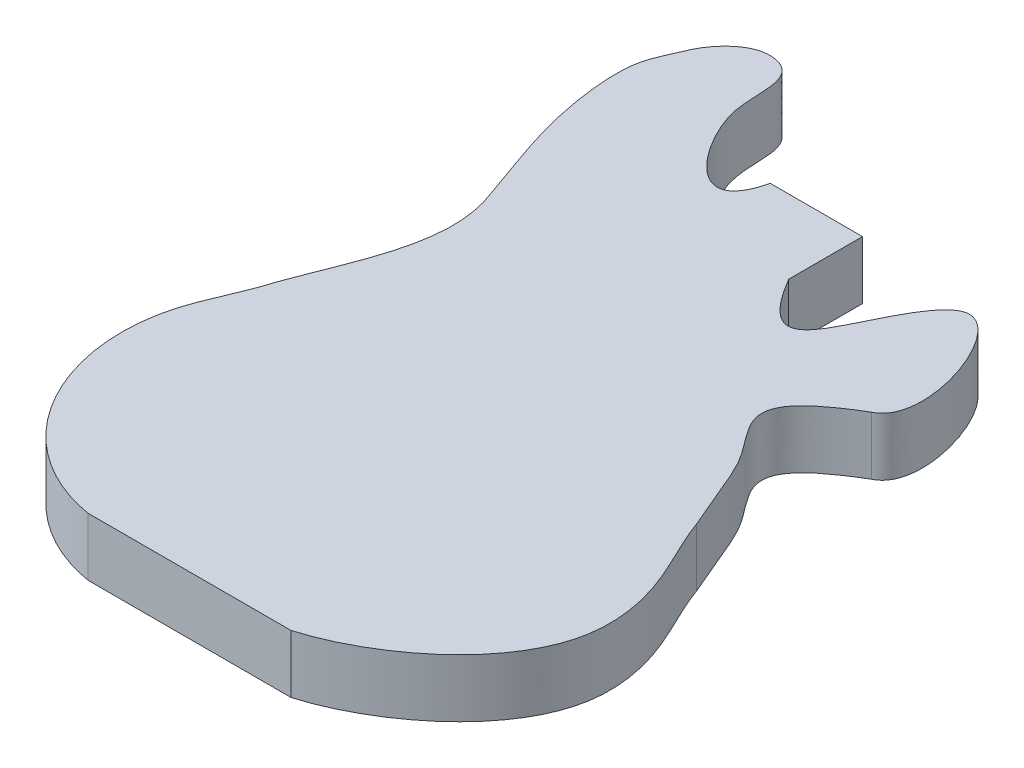
from build123d import *

# Parameters (mm, degrees)
BOSS_EXTRUDE1_DEPTH = 40.005


with BuildPart() as part:
    # Sketch1 → Boss-Extrude1 (new body)
    with BuildSketch(Plane(origin=(0, 0, 0), x_dir=(1, 0, 0), z_dir=(0, 1, 0))):
        with BuildLine():
            Line((-31.75, 431.8), (31.75, 431.8))
            Line((31.75, 431.8), (31.75, 381))
            add(Edge.make_bspline(
                [(139.7, 330.2), (166.445933937, 342.89199921), (123.503776034, 464.530793204), (76.812686628, 369.38946014), (59.509313942, 333.666820551), (31.75, 381)],
                knots=[0, 0, 0, 0, 0.451982316, 0.679896033, 1, 1, 1, 1], degree=3))
            add(Edge.make_bspline(
                [(146.05, 203.2), (136.159858324, 225.650446788), (132.589610525, 236.847424982), (120.383558334, 260.933031596), (109.568716266, 273.359552136), (96.590167779, 297.02427137), (109.096273913, 311.992671669), (139.7, 330.2)],
                knots=[0, 0, 0, 0, 0.338979618, 0.396393174, 0.554386404, 0.616722002, 1, 1, 1, 1], degree=3))
            add(Edge.make_bspline(
                [(69.85, 0), (111.934817577, 12.111106324), (186.014505262, 65.749693466), (170.841604559, 155.498343774), (152.338106065, 185.626315347), (146.05, 203.2)],
                knots=[0, 0, 0, 0, 0.586136039, 0.784814246, 1, 1, 1, 1], degree=3))
            Line((69.85, 0), (-69.85, 0))
            add(Edge.make_bspline(
                [(-69.85, 0), (-122.745853908, 8.894627237), (-170.373818617, 68.373598191), (-165.531190573, 154.759290659), (-147.834713243, 185.810503286), (-142.875, 203.2)],
                knots=[0, 0, 0, 0, 0.581043163, 0.78383742, 1, 1, 1, 1], degree=3))
            add(Edge.make_bspline(
                [(-142.875, 203.2), (-128.639770906, 243.099083108), (-104.490445622, 285.950192917), (-122.2248, 330.2)],
                knots=[0, 0, 0, 0, 1, 1, 1, 1], degree=3))
            add(Edge.make_bspline(
                [(-122.2248, 330.2), (-131.763508886, 357.856604277), (-146.2425508, 392.351504834), (-152.772633421, 455.278086227), (-144.543275129, 471.013225285), (-135.470443556, 492.861244858), (-120.651127827, 508.750910027), (-90.829721956, 507.317797539), (-88.364588713, 481.720202384), (-88.704714068, 444.441923985), (-43.011483466, 384.645662013), (-31.75, 431.8)],
                knots=[0, 0, 0, 0, 0.228270644, 0.373680854, 0.455314812, 0.473381506, 0.54535154, 0.564858815, 0.659457996, 0.74420055, 1, 1, 1, 1], degree=3))
        make_face()
    extrude(amount=BOSS_EXTRUDE1_DEPTH)


solid = part.part
